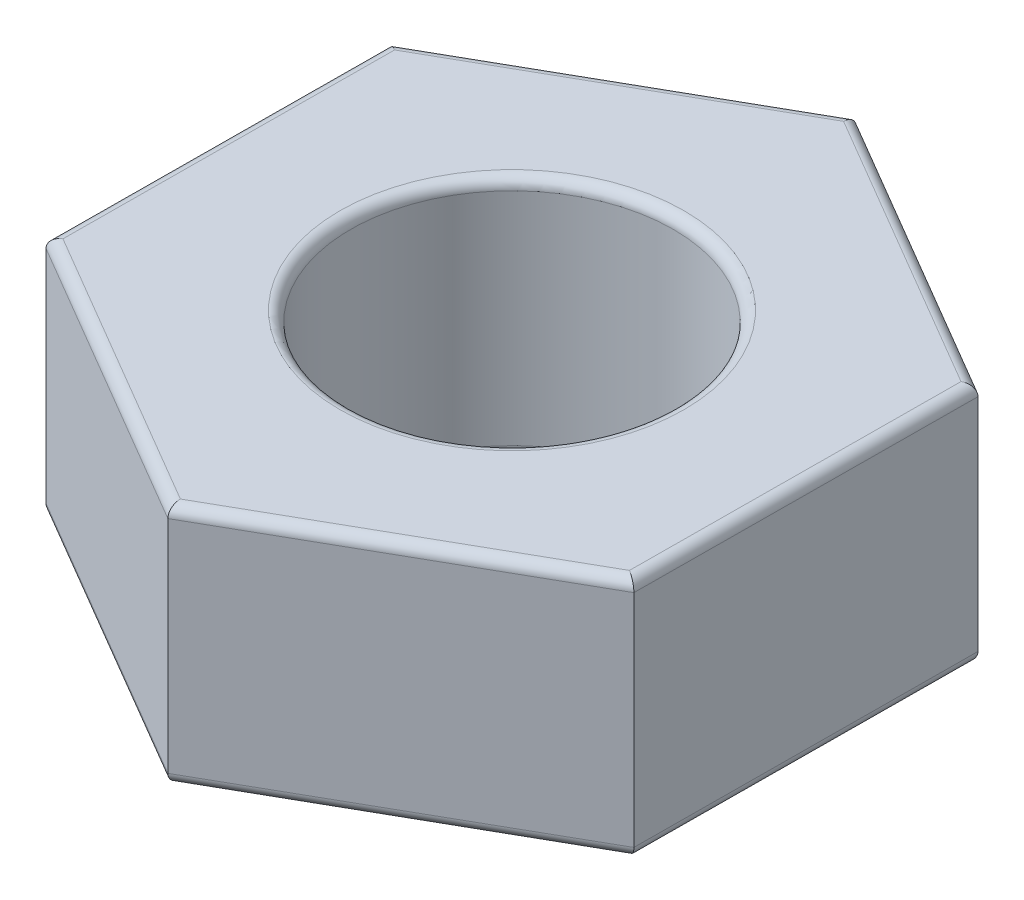
from build123d import *

# Parameters (mm, degrees)
SKETCH1_R           = 1.5
BOSS_EXTRUDE1_DEPTH = 2.25
FILLET1_R           = 0.1


with BuildPart() as part:
    # Sketch1 → Boss-Extrude1 (new body)
    with BuildSketch(Plane(origin=(0, 0, 0), x_dir=(1, 0, 0), z_dir=(0, 1, 0))):
        Polygon((2.739003368, -1.606609438), (2.760866271, 1.568741778), (0.021862903, 3.175351216), (-2.739003368, 1.606609438), (-2.760866271, -1.568741778), (-0.021862903, -3.175351216), align=None)
        Circle(SKETCH1_R, mode=Mode.SUBTRACT)
    extrude(amount=BOSS_EXTRUDE1_DEPTH)

    # Fillet1
    fillet1_edges = [part.edges().sort_by_distance(p)[0] for p in [
        (-1.5, 0, 0),
        (2.749934819, 0, 0.01893383),
        (1.391364587, 0, -2.372046497),
        (-1.358570232, 0, -2.390980327),
        (-2.749934819, 0, -0.01893383),
        (-1.391364587, 0, 2.372046497),
        (1.358570232, 0, 2.390980327),
        (-1.5, 2.25, 0),
        (-1.391364587, 2.25, 2.372046497),
        (-2.749934819, 2.25, -0.01893383),
        (-1.358570232, 2.25, -2.390980327),
        (1.391364587, 2.25, -2.372046497),
        (2.749934819, 2.25, 0.01893383),
        (1.358570232, 2.25, 2.390980327),
    ]]
    fillet(fillet1_edges, radius=FILLET1_R)


solid = part.part
